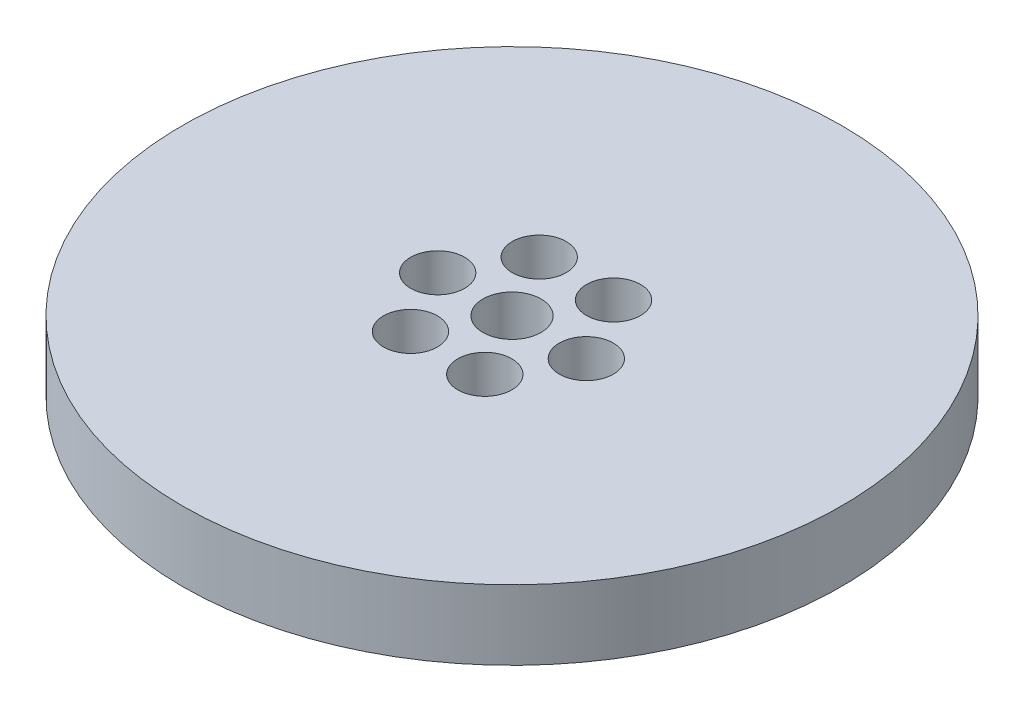
from build123d import *

# Parameters (mm, degrees)
SKETCH1_R           = 85
BOSS_EXTRUDE1_DEPTH = 18
SKETCH2_R           = 7.5
CUT_EXTRUDE1_DEPTH  = 122.548344291
SKETCH3_R           = 6.965959256
CUT_EXTRUDE2_DEPTH  = 11.094337504
CIRPATTERN1_COUNT   = 6


with BuildPart() as part:
    # Sketch1 → Boss-Extrude1 (new body)
    with BuildSketch(Plane(origin=(0, 0, 0), x_dir=(1, 0, 0), z_dir=(0, 1, 0))):
        Circle(SKETCH1_R)
    extrude(amount=BOSS_EXTRUDE1_DEPTH)

    # Sketch2 → Cut-Extrude1 (cut, through all)
    with BuildSketch(Plane(origin=(0, 0, 0), x_dir=(1, 0, 0), z_dir=(0, 1, 0))):
        Circle(SKETCH2_R)
    extrude(amount=CUT_EXTRUDE1_DEPTH, mode=Mode.SUBTRACT)

    # Sketch3 → Cut-Extrude2 (cut)
    with BuildSketch(Plane(origin=(0, 18, 0), x_dir=(1, 0, 0), z_dir=(0, 1, 0))):
        with Locations((-19.170580293, 0)):
            Circle(SKETCH3_R)
    cut_extrude2 = extrude(amount=-CUT_EXTRUDE2_DEPTH, mode=Mode.SUBTRACT)

    # CirPattern1: Cut-Extrude2 ×6 about axis
    cirpattern1_axis = Axis((0, 0, 0), (0, 1, 0))
    for i in range(1, CIRPATTERN1_COUNT):
        add(cut_extrude2.rotate(cirpattern1_axis, i * 360 / CIRPATTERN1_COUNT), mode=Mode.SUBTRACT)


solid = part.part
